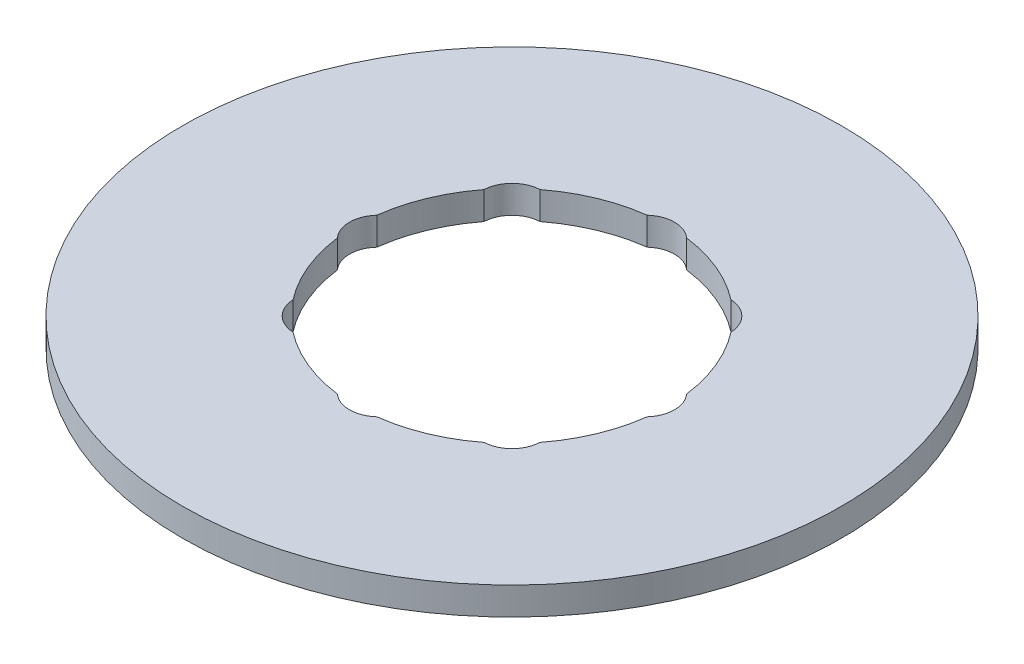
from build123d import *

# Parameters (mm, degrees)
SKETCH1_R           = 47.5
BOSS_EXTRUDE1_DEPTH = 4
SKETCH2_R           = 22.5
CUT_EXTRUDE1_DEPTH  = 68.294130502
SKETCH3_R           = 4.231561453
CUT_EXTRUDE2_DEPTH  = 4
CIRPATTERN1_DEPTH   = 4


# Read off the part's stored shape, not the designer's step: CirPattern1
with BuildPart() as part:
    # Sketch1 → Boss-Extrude1 (new body)
    with BuildSketch(Plane(origin=(0, 0, 0), x_dir=(1, 0, 0), z_dir=(0, 1, 0))):
        with Locations(Location((0, 0, 0), (0, 0, 270))):
            Circle(SKETCH1_R)
    extrude(amount=BOSS_EXTRUDE1_DEPTH)

    # Sketch2 → Cut-Extrude1 (cut, through all)
    with BuildSketch(Plane(origin=(0, 0, 0), x_dir=(1, 0, 0), z_dir=(0, 1, 0))):
        with Locations(Location((0, 0, 0), (0, 0, 270))):
            Circle(SKETCH2_R)
    extrude(amount=CUT_EXTRUDE1_DEPTH, mode=Mode.SUBTRACT)

    # Sketch3 → Cut-Extrude2 (cut)
    with BuildSketch(Plane(origin=(0, 4, 0), x_dir=(1, 0, 0), z_dir=(0, 1, 0))):
        with Locations((-19.192330033, 0)):
            Circle(SKETCH3_R)
    extrude(amount=-CUT_EXTRUDE2_DEPTH, mode=Mode.SUBTRACT)

    # CirPattern1 outline → CirPattern1 (cut)
    with BuildSketch(Plane(origin=(0, 0, 0), x_dir=(1, 0, 0), z_dir=(0, 1, 0))):
        with BuildLine():
            ThreePointArc((-13.765038141, -17.798138245), (-15.909902577, -15.909902577), (-17.798138245, -13.765038141))
            ThreePointArc((-17.798138245, -13.765038141), (-16.563192512, -16.563192512), (-13.765038141, -17.798138245))
        make_face()
        with BuildLine():
            ThreePointArc((-17.798138245, 13.765038141), (-15.909902577, 15.909902577), (-13.765038141, 17.798138245))
            ThreePointArc((-13.765038141, 17.798138245), (-16.563192512, 16.563192512), (-17.798138245, 13.765038141))
        make_face()
        with BuildLine():
            ThreePointArc((-2.851832433, 22.318536059), (0, 22.500000001), (2.851832433, 22.318536059))
            ThreePointArc((2.851832433, 22.318536059), (0, 23.423891487), (-2.851832433, 22.318536059))
        make_face()
        with BuildLine():
            ThreePointArc((13.765038141, 17.798138245), (15.909902577, 15.909902577), (17.798138245, 13.765038141))
            ThreePointArc((17.798138245, 13.765038141), (16.563192512, 16.563192512), (13.765038141, 17.798138245))
        make_face()
        with BuildLine():
            ThreePointArc((22.318536058, 2.851832433), (22.5, 0), (22.318536058, -2.851832433))
            ThreePointArc((22.318536058, -2.851832433), (23.423891487, 0), (22.318536058, 2.851832433))
        make_face()
        with BuildLine():
            ThreePointArc((17.798138245, -13.765038141), (15.909902576, -15.909902576), (13.765038141, -17.798138244))
            ThreePointArc((13.765038141, -17.798138244), (16.563192512, -16.563192512), (17.798138245, -13.765038141))
        make_face()
        with BuildLine():
            ThreePointArc((2.851832433, -22.318536058), (0, -22.499999999), (-2.851832433, -22.318536058))
            ThreePointArc((-2.851832433, -22.318536058), (0, -23.423891487), (2.851832433, -22.318536058))
        make_face()
    extrude(amount=CIRPATTERN1_DEPTH, mode=Mode.SUBTRACT)


solid = part.part
